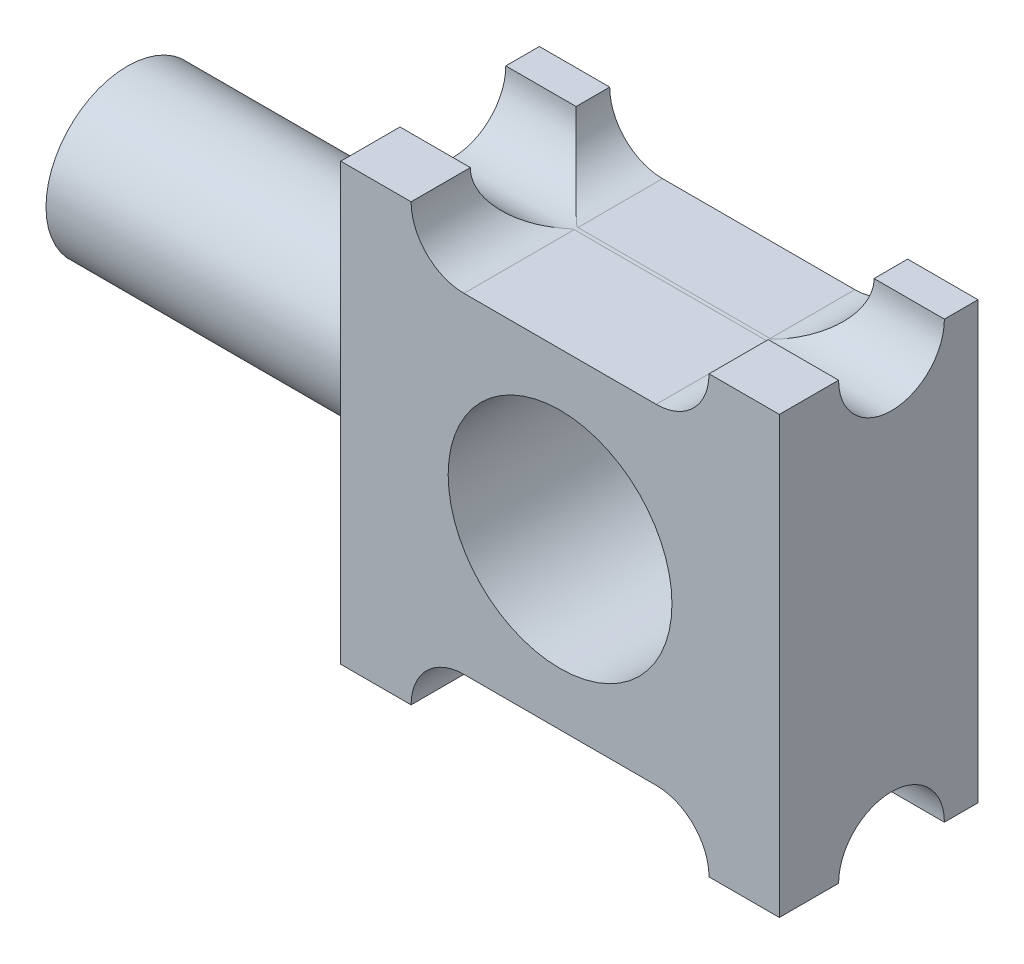
from build123d import *

# Parameters (mm, degrees)
SKETCH1_W           = 13.6906
SKETCH1_H           = 13.6
BOSS_EXTRUDE1_DEPTH = 6.2
SKETCH2_R           = 1.651
CUT_EXTRUDE1_DEPTH  = 17.495833667
CUT_EXTRUDE2_DEPTH  = 12.469007459
SKETCH4_R           = 3.4925
CUT_EXTRUDE3_DEPTH  = 12.469007632
SKETCH5_R           = 2.54
BOSS_EXTRUDE2_DEPTH = 10.16


with BuildPart() as part:
    # Sketch1 → Boss-Extrude1 (new body)
    with BuildSketch(Plane.XY):
        Rectangle(SKETCH1_W, SKETCH1_H)
    extrude(amount=BOSS_EXTRUDE1_DEPTH)

    # Sketch2 → Cut-Extrude1 (cut, through all)
    with BuildSketch(Plane(origin=(6.8453, 0, 0), x_dir=(0, 0, -1), z_dir=(1, 0, 0))):
        with Locations((-2.7, 6.8)):
            Circle(SKETCH2_R)
        with Locations((-2.7, -6.8)):
            Circle(SKETCH2_R)
    extrude(amount=-CUT_EXTRUDE1_DEPTH, mode=Mode.SUBTRACT)

    # Sketch3 → Cut-Extrude2 (cut, through all)
    with BuildSketch(Plane.XY.offset(6.2)):
        with BuildLine():
            ThreePointArc((-4.65, 6.8), (-4.166726189, 5.633273811), (-3, 5.15))
            Line((-3, 5.15), (3, 5.15))
            ThreePointArc((3, 5.15), (4.166726189, 5.633273811), (4.65, 6.8))
            Line((4.65, 6.8), (-4.65, 6.8))
        make_face()
        with BuildLine():
            ThreePointArc((4.65, -6.8), (4.166726189, -5.633273811), (3, -5.15))
            Line((3, -5.15), (-3, -5.15))
            ThreePointArc((-3, -5.15), (-4.166726189, -5.633273811), (-4.65, -6.8))
            Line((-4.65, -6.8), (4.65, -6.8))
        make_face()
    extrude(amount=-CUT_EXTRUDE2_DEPTH, mode=Mode.SUBTRACT)

    # Sketch4 → Cut-Extrude3 (cut, through all)
    with BuildSketch(Plane.XY.offset(6.2)):
        Circle(SKETCH4_R)
    extrude(amount=-CUT_EXTRUDE3_DEPTH, mode=Mode.SUBTRACT)

    # Sketch5 → Boss-Extrude2 (add)
    with BuildSketch(Plane.ZY.offset(6.8453)):
        with Locations((2.7, 0)):
            Circle(SKETCH5_R)
    extrude(amount=BOSS_EXTRUDE2_DEPTH)


solid = part.part
